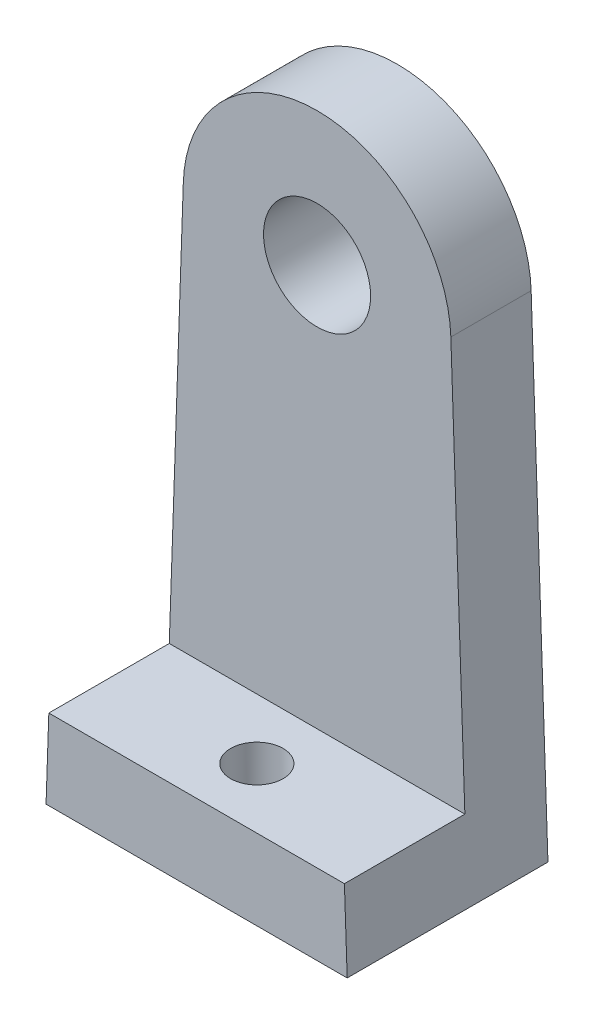
from build123d import *

# Parameters (mm, degrees)
BOSS_EXTRUDE1_DEPTH = 3.81
BOSS_EXTRUDE2_START = 3.81
BOSS_EXTRUDE2_DEPTH = 11.43
SKETCH3_R           = 5.08
CUT_EXTRUDE1_DEPTH  = 20
SKETCH4_R           = 2.4892
CUT_EXTRUDE2_DEPTH  = 20


with BuildPart() as part:
    # Sketch1 → Boss-Extrude1 (new, symmetric)
    with BuildSketch(Plane.XY):
        with BuildLine():
            Line((-14.2875, 0), (14.2875, 0))
            Line((14.2875, 0), (12.692423957, 46.158604709))
            ThreePointArc((12.692423957, 46.158604709), (0, 58.42), (-12.692423957, 46.158604709))
            Line((-12.692423957, 46.158604709), (-14.2875, 0))
        make_face()
    extrude(amount=BOSS_EXTRUDE1_DEPTH, both=True)

    # Sketch2 → Boss-Extrude2 (add)
    with BuildSketch(Plane.XY.offset(BOSS_EXTRUDE2_START)):
        Polygon((-14.2875, 0), (14.2875, 0), (14.024180094, 7.62), (-14.024180094, 7.62), align=None)
    extrude(amount=BOSS_EXTRUDE2_DEPTH)

    # Sketch3 → Cut-Extrude1 (cut, symmetric)
    with BuildSketch(Plane.XY):
        with Locations((0, 45.72)):
            Circle(SKETCH3_R)
    extrude(amount=CUT_EXTRUDE1_DEPTH, both=True, mode=Mode.SUBTRACT)

    # Sketch4 → Cut-Extrude2 (cut, symmetric)
    with BuildSketch(Plane(origin=(0, 0, 0), x_dir=(1, 0, 0), z_dir=(0, 1, 0))):
        with Locations((0, -9.525)):
            Circle(SKETCH4_R)
    extrude(amount=CUT_EXTRUDE2_DEPTH, both=True, mode=Mode.SUBTRACT)


solid = part.part
